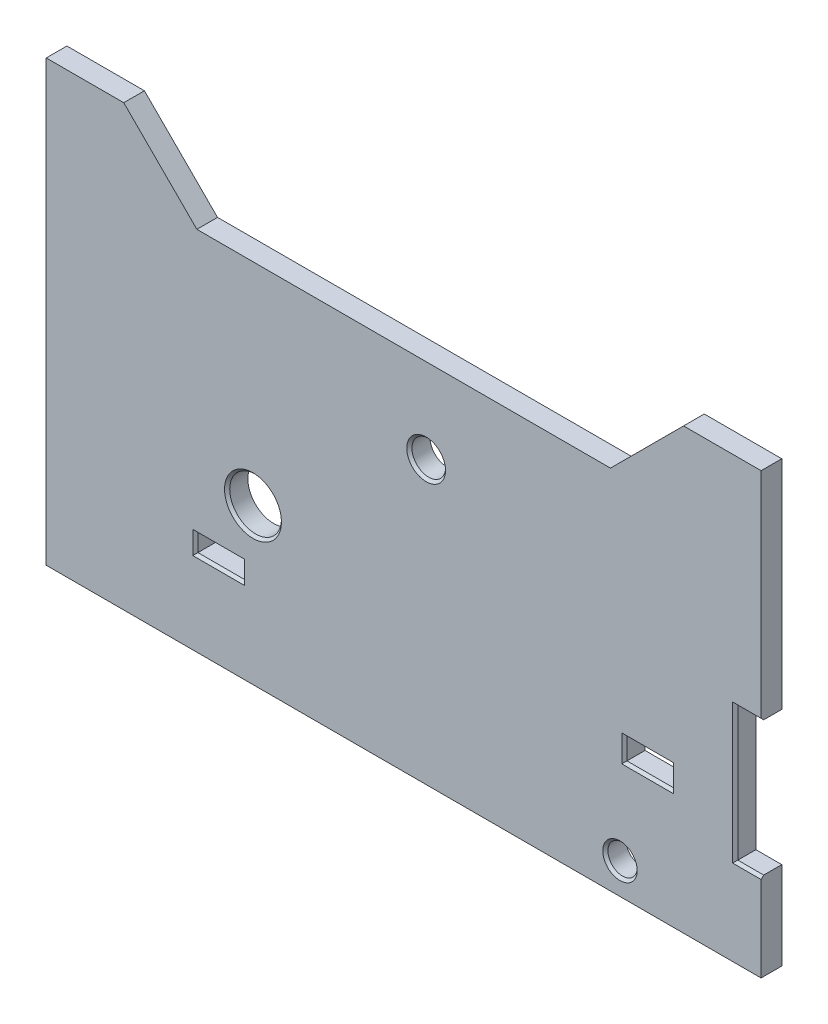
from build123d import *

# Parameters (mm, degrees)
SKETCH1_R           = 5
SKETCH1_R_2         = 2.83
SKETCH1_R_3         = 3.25
SKETCH1_W           = 9
SKETCH1_H           = 4.2
SKETCH1_H_2         = 3.4
BOSS_EXTRUDE1_DEPTH = 2
BOSS_EXTRUDE2_DEPTH = 2
CHAMFER1_SIZE       = 0.5


with BuildPart() as part:
    # Sketch1 → Boss-Extrude1 (new, symmetric)
    with BuildSketch(Plane.XY):
        Polygon((-86, -30), (-86, 30), (52.3, 30), (52.3, 13), (47.3, 13), (47.3, -13), (52.3, -13), (52.3, -30), align=None)
        with Locations((-46, 0)):
            Circle(SKETCH1_R, mode=Mode.SUBTRACT)
        with Locations((25, -24)):
            Circle(SKETCH1_R_2, mode=Mode.SUBTRACT)
        with Locations((-12.5, 24.5)):
            Circle(SKETCH1_R_3, mode=Mode.SUBTRACT)
        with Locations((30.35, -5)):
            Rectangle(SKETCH1_W, SKETCH1_H, mode=Mode.SUBTRACT)
        with Locations((-52.65, -12)):
            Rectangle(SKETCH1_W, SKETCH1_H_2, mode=Mode.SUBTRACT)
    extrude(amount=BOSS_EXTRUDE1_DEPTH, both=True)

    # Sketch2 → Boss-Extrude2 (add, symmetric)
    with BuildSketch(Plane.XY):
        Polygon((-86, 30), (52.3, 30), (52.3, 55), (37.3, 55), (23.157864376, 40.857864376), (-56.857864376, 40.857864376), (-71, 55), (-86, 55), align=None)
    extrude(amount=BOSS_EXTRUDE2_DEPTH, both=True)

    # Chamfer1
    chamfer1_edges = [part.edges().sort_by_distance(p)[0] for p in [
        (49.8, -13, 2),
        (49.8, 13, 2),
        (47.3, 0, 2),
        (22.17, -24, 2),
        (30.35, -7.1, 2),
        (25.85, -5, 2),
        (30.35, -2.9, 2),
        (34.85, -5, 2),
        (-48.15, -12, 2),
        (-52.65, -13.7, 2),
        (-57.15, -12, 2),
        (-52.65, -10.3, 2),
        (-51, 0, 2),
        (-15.75, 24.5, 2),
    ]]
    chamfer(chamfer1_edges, length=CHAMFER1_SIZE)


solid = part.part
